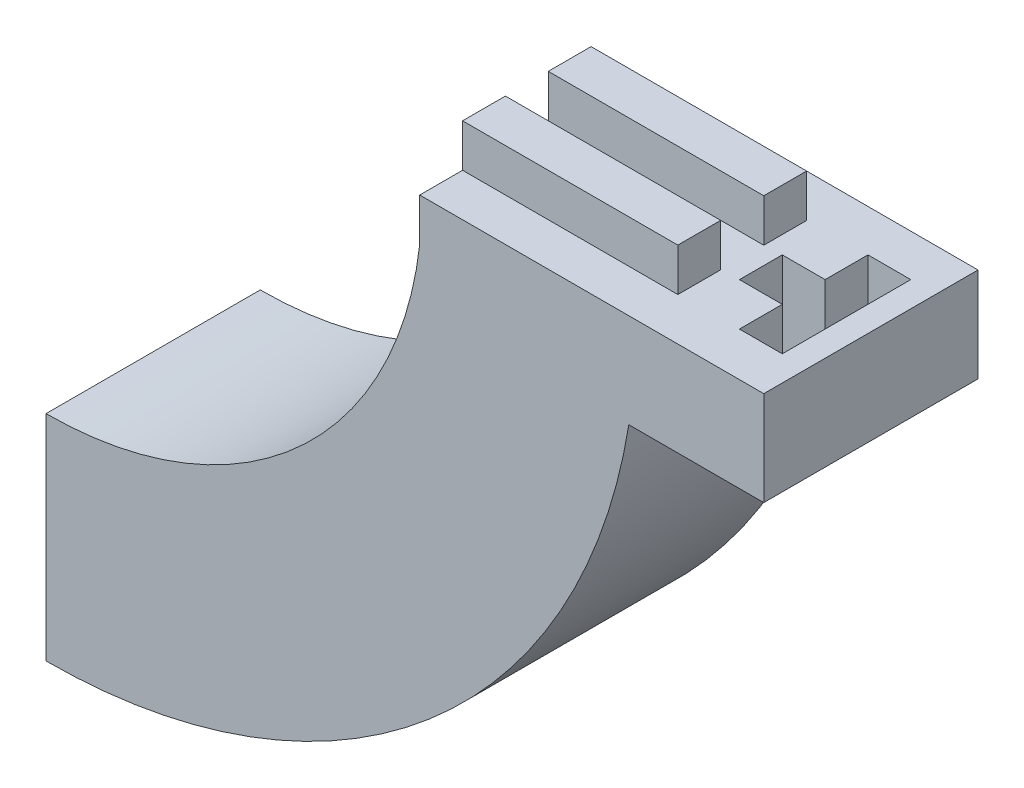
from build123d import *

# Parameters (mm, degrees)
SKETCH1_R               = 35
SKETCH1_R_2             = 22.3
BOSS_EXTRUDE2_DEPTH     = 12.7
SKETCH4_W               = 2.54
SKETCH4_H               = 76.791301982
SKETCH4_W_2             = 87.412375573
SKETCH4_H_2             = 2.54
CUT_EXTRUDE_THIN4_DEPTH = 12.7
SKETCH7_W               = 12.775704106
SKETCH7_H               = 12.7
BOSS_EXTRUDE3_DEPTH     = 2.54
SKETCH11_W              = 12.775704106
SKETCH11_H              = 2.54
SKETCH11_W_2            = 12.761411891
BOSS_EXTRUDE6_DEPTH     = 2.54
SKETCH12_W              = 12.7
SKETCH12_H              = 5.594236833
BOSS_EXTRUDE7_DEPTH     = 7.62
SKETCH12_2_W            = 12.7
SKETCH12_2_H            = 5.594236833
BOSS_EXTRUDE8_DEPTH     = 2.54
CAVITY3_START           = 38.513729061
CAVITY3_OUTLINE_W       = 5.594236833
CAVITY3_OUTLINE_H       = 7.62
CAVITY3_DEPTH           = 2.54
CAVITY3_START_2         = 35.973729061
CAVITY3_2_OUTLINE_W     = 5.594236833
CAVITY3_2_OUTLINE_H     = 2.54
CAVITY3_2_DEPTH         = 2.54


# Read off the part's stored shape, not the designer's step: Cavity3
with BuildPart() as part:
    # Sketch1 → Boss-Extrude2 (new body)
    with BuildSketch(Plane.XY):
        Circle(SKETCH1_R)
        Circle(SKETCH1_R_2, mode=Mode.SUBTRACT)
    extrude(amount=BOSS_EXTRUDE2_DEPTH)

    # Sketch4 → Cut-Extrude-Thin4 (cut)
    with BuildSketch(Plane.XY.offset(12.7)):
        with Locations((-1.27, -1.456872926)):
            Rectangle(SKETCH4_W, SKETCH4_H)
        with Locations((4.088643373, -1.27)):
            Rectangle(SKETCH4_W_2, SKETCH4_H_2)
    extrude(amount=-CUT_EXTRUDE_THIN4_DEPTH, mode=Mode.SUBTRACT)


with BuildPart() as body_2:
    # of the pieces the cut leaves, the one that is kept (cut_extrude_thin4_keep)
    add(part.part.solids().sort_by_distance((34.907712615, -2.54, 12.7))[0])

    # Sketch7 → Boss-Extrude3 (add)
    with BuildSketch(Plane(origin=(0, -2.54, 0), x_dir=(1, 0, 0), z_dir=(0, 1, 0))):
        with Locations((28.542725106, -6.35)):
            Rectangle(SKETCH7_W, SKETCH7_H)
    extrude(amount=BOSS_EXTRUDE3_DEPTH)

    # Sketch11 → Boss-Extrude6 (add)
    with BuildSketch(Plane(origin=(0, 0, 0), x_dir=(1, 0, 0), z_dir=(0, 1, 0))):
        with Locations((28.542725106, -3.81)):
            Rectangle(SKETCH11_W, SKETCH11_H)
        with Locations((28.535578999, -8.89)):
            Rectangle(SKETCH11_W_2, SKETCH11_H)
    extrude(amount=BOSS_EXTRUDE6_DEPTH)

    # Sketch12 → Boss-Extrude7 (add)
    with BuildSketch(Plane(origin=(34.930577159, 0, 0), x_dir=(0, 0, -1), z_dir=(1, 0, 0))):
        with Locations((-6.35, -2.797118417)):
            Rectangle(SKETCH12_W, SKETCH12_H)
    extrude(amount=BOSS_EXTRUDE7_DEPTH)

    # Sketch12<2> → Boss-Extrude8 (add)
    with BuildSketch(Plane(origin=(34.930577159, 0, 0), x_dir=(0, 0, -1), z_dir=(1, 0, 0))):
        with Locations((-6.35, -2.797118417)):
            Rectangle(SKETCH12_2_W, SKETCH12_2_H)
    extrude(amount=-BOSS_EXTRUDE8_DEPTH)

    # Cavity3 outline → Cavity3 (cut)
    with BuildSketch(Plane.YZ.offset(CAVITY3_START)):
        with Locations((-2.797118417, 6.296394857)):
            Rectangle(CAVITY3_OUTLINE_W, CAVITY3_OUTLINE_H)
    extrude(amount=CAVITY3_DEPTH, mode=Mode.SUBTRACT)

    # Cavity3 2 outline → Cavity3 2 (cut)
    with BuildSketch(Plane.YZ.offset(CAVITY3_START_2)):
        with Locations((-2.797118417, 6.296394857)):
            Rectangle(CAVITY3_2_OUTLINE_W, CAVITY3_2_OUTLINE_H)
    extrude(amount=CAVITY3_2_DEPTH, mode=Mode.SUBTRACT)


solid = body_2.part
